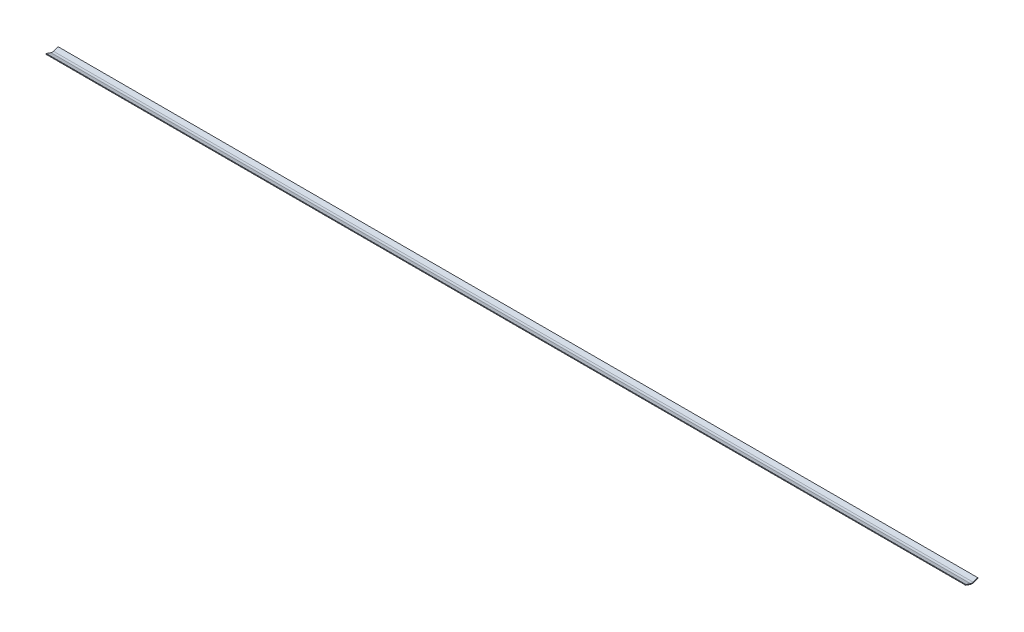
from build123d import *

# Parameters (mm, degrees)
BASE_FLANGE1_DEPTH = 1499


# Sheet-metal steps are written as plain solids
with BuildPart() as part:
    # Sketch1 → Base-Flange1 (new, symmetric)
    with BuildSketch(Plane(origin=(0, 0, 0), x_dir=(0, 0, -1), z_dir=(1, 0, 0))):
        with BuildLine():
            Line((-20, 6.825396825), (-4.844696692, 1.653348871))
            ThreePointArc((-4.844696692, 1.653348871), (0, 0.849436852), (4.844696692, 1.653348871))
            Line((4.844696692, 1.653348871), (20, 6.825396825))
            Line((20, 6.825396825), (19.354040441, 8.718208556))
            Line((19.354040441, 8.718208556), (4.198737133, 3.546160602))
            ThreePointArc((4.198737133, 3.546160602), (0, 2.849436852), (-4.198737133, 3.546160602))
            Line((-4.198737133, 3.546160602), (-19.354040441, 8.718208556))
            Line((-19.354040441, 8.718208556), (-20, 6.825396825))
        make_face()
    extrude(amount=BASE_FLANGE1_DEPTH, both=True)


solid = part.part
